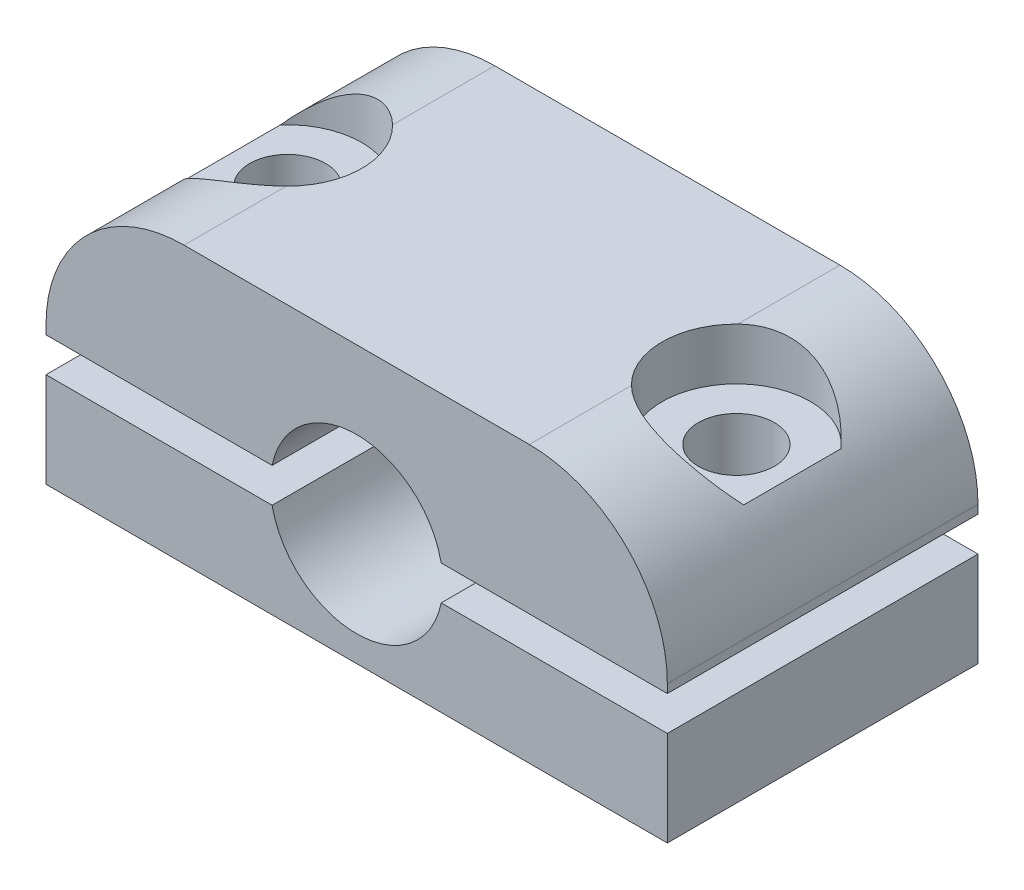
from build123d import *

# Parameters (mm, degrees)
SKETCH_1_W          = 36
SKETCH_1_H          = 18
EXTRUDE_1_DEPTH     = 16
SKETCH_2_W          = 16
SKETCH_2_H          = 6
EXTRUDE_2_DEPTH     = 3
SKETCH_3_R          = 2.2
CUT_EXTRUDE_1_DEPTH = 30
CUT_EXTRUDE_2_DEPTH = 30
FILLET_START        = -18
FILLET_1_DEPTH      = 18
SKETCH_8_R          = 4.3
CUT_EXTRUDE_6_DEPTH = 3


with BuildPart() as part:
    # Эскиз1 → Бобышка-Вытянуть1 (new body)
    with BuildSketch(Plane(origin=(0, 0, 0), x_dir=(1, 0, 0), z_dir=(0, 1, 0))):
        with Locations((18, 9)):
            Rectangle(SKETCH_1_W, SKETCH_1_H)
    extrude(amount=EXTRUDE_1_DEPTH)

    # Эскиз2 → Бобышка-Вытянуть2 (add)
    with BuildSketch(Plane.XZ):
        with Locations((18, -9)):
            Rectangle(SKETCH_2_W, SKETCH_2_H)
    extrude(amount=EXTRUDE_2_DEPTH)

    # Эскиз3 → Вырез-Вытянуть1 (cut)
    with BuildSketch(Plane.XZ):
        with Locations(Location((5, -9, 0), (0, 0, 270))):
            Circle(SKETCH_3_R)
        with Locations(Location((31, -9, 0), (0, 0, 270))):
            Circle(SKETCH_3_R)
    extrude(amount=-CUT_EXTRUDE_1_DEPTH, mode=Mode.SUBTRACT)

    # Эскиз4 → Вырез-Вытянуть2 (cut)
    with BuildSketch(Plane.XY):
        with BuildLine():
            Line((13.101020514, 7.5), (22.898979486, 7.5))
            ThreePointArc((22.898979486, 7.5), (18, 11.5), (13.101020514, 7.5))
        make_face()
        with BuildLine():
            ThreePointArc((23, 6.5), (22.974680765, 7.00254481), (22.898979486, 7.5))
            Line((22.898979486, 7.5), (13.101020514, 7.5))
            ThreePointArc((13.101020514, 7.5), (13, 6.5), (13.101020514, 5.5))
            Line((13.101020514, 5.5), (22.898979486, 5.5))
            ThreePointArc((22.898979486, 5.5), (22.974680765, 5.99745519), (23, 6.5))
        make_face()
        with BuildLine():
            ThreePointArc((13.101020514, 5.5), (18, 1.5), (22.898979486, 5.5))
            Line((22.898979486, 5.5), (13.101020514, 5.5))
        make_face()
        with BuildLine():
            ThreePointArc((13.101020514, 5.5), (13, 6.5), (13.101020514, 7.5))
            Line((13.101020514, 7.5), (0, 7.5))
            Line((0, 7.5), (0, 5.5))
            Line((0, 5.5), (13.101020514, 5.5))
        make_face()
        with BuildLine():
            Line((36, 5.5), (36, 7.5))
            Line((36, 7.5), (22.898979486, 7.5))
            ThreePointArc((22.898979486, 7.5), (22.974680765, 7.00254481), (23, 6.5))
            ThreePointArc((23, 6.5), (22.974680765, 5.99745519), (22.898979486, 5.5))
            Line((22.898979486, 5.5), (36, 5.5))
        make_face()
    extrude(amount=-CUT_EXTRUDE_2_DEPTH, mode=Mode.SUBTRACT)


with BuildPart() as cut_extrude_2_piece_1:
    # of the separate pieces the step leaves, piece 1, a body of its own (cut_extrude_2_pieces)
    add(part.part.solids().sort_by_distance((13.101020514, 7.5, 0))[0])

    # Скругление1: read off the stored shape, not the designer's step
    # Скругление1 outline → Скругление1 (cut)
    with BuildSketch(Plane.XY.offset(FILLET_START)):
        with BuildLine():
            ThreePointArc((0, 8), (2.343145751, 13.656854249), (8, 16))
            Line((8, 16), (0, 16))
            Line((0, 16), (0, 8))
        make_face()
        with BuildLine():
            Line((36, 16), (28, 16))
            ThreePointArc((28, 16), (33.656854249, 13.656854249), (36, 8))
            Line((36, 8), (36, 16))
        make_face()
    extrude(amount=FILLET_1_DEPTH, mode=Mode.SUBTRACT)

    # Эскиз8 → Вырез-Вытянуть6 (cut)
    with BuildSketch(Plane(origin=(0, 16, 0), x_dir=(1, 0, 0), z_dir=(0, 1, 0))):
        with Locations((5, 9)):
            Circle(SKETCH_8_R)
        with Locations((31, 9)):
            Circle(SKETCH_8_R)
    extrude(amount=-CUT_EXTRUDE_6_DEPTH, mode=Mode.SUBTRACT)


with BuildPart() as cut_extrude_2_piece_2:
    # of the separate pieces the step leaves, piece 2, a body of its own (cut_extrude_2_pieces)
    add(part.part.solids().sort_by_distance((0, 0, 0))[0])


solid = Compound([cut_extrude_2_piece_1.part, cut_extrude_2_piece_2.part])
